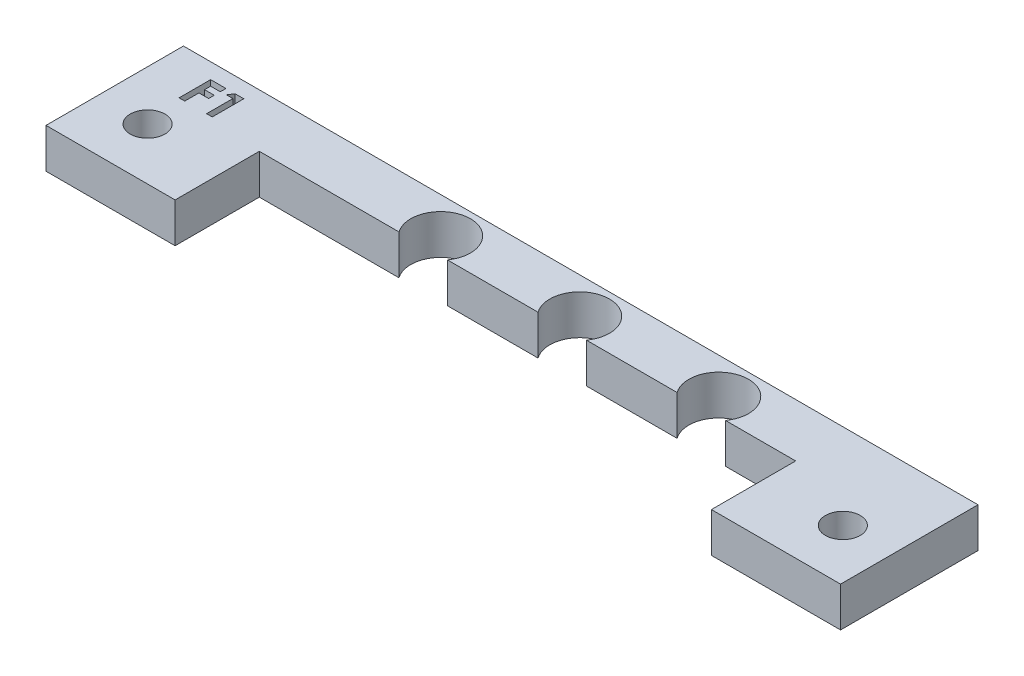
from build123d import *

# Parameters (mm, degrees)
SKETCH1_R           = 1.75
BOSS_EXTRUDE1_DEPTH = 4
CUT_EXTRUDE1_DEPTH  = 1


with BuildPart() as part:
    # Sketch1 → Boss-Extrude1 (new body)
    with BuildSketch(Plane(origin=(0, 0, 0), x_dir=(1, 0, 0), z_dir=(0, 1, 0))):
        with BuildLine():
            Line((-19.620223818, -18.81631662), (-6.620223818, -18.81631662))
            Line((-6.620223818, -18.81631662), (-6.620223818, -10.337442774))
            Line((-6.620223818, -10.337442774), (7.443077754, -10.337442546))
            ThreePointArc((7.443077754, -10.337442546), (9.879776182, -5.587442326), (12.31647461, -10.337442546))
            Line((12.31647461, -10.337442546), (21.443077647, -10.337442397))
            ThreePointArc((21.443077647, -10.337442397), (23.879776182, -5.587442326), (26.316474717, -10.337442397))
            Line((26.316474717, -10.337442397), (35.443077673, -10.337442433))
            ThreePointArc((35.443077673, -10.337442433), (37.879776182, -5.587442326), (40.316474692, -10.337442433))
            Line((40.316474692, -10.337442433), (47.379776182, -10.33744254))
            Line((47.379776182, -10.33744254), (47.379776182, -18.81631662))
            Line((47.379776182, -18.81631662), (60.379776182, -18.81631662))
            Line((60.379776182, -18.81631662), (60.379776182, -4.977921711))
            Line((60.379776182, -4.977921711), (-19.620223818, -4.977921711))
            Line((-19.620223818, -4.977921711), (-19.620223818, -18.81631662))
        make_face()
        with Locations((-14.620223818, -13.58744255)):
            Circle(SKETCH1_R, mode=Mode.SUBTRACT)
        with Locations((55.379776182, -13.58744255)):
            Circle(SKETCH1_R, mode=Mode.SUBTRACT)
    extrude(amount=BOSS_EXTRUDE1_DEPTH)

    # Sketch2 → Cut-Extrude1 (cut)
    with BuildSketch(Plane(origin=(0, 4, 0), x_dir=(1, 0, 0), z_dir=(0, 1, 0))):
        Polygon((-15.320752279, -6.539659084), (-13.773957408, -6.539659084), (-13.773957408, -7.109530878), (-14.750880484, -7.109530878), (-14.750880484, -7.720107802), (-13.773957408, -7.720107802), (-13.773957408, -8.289979596), (-14.750880484, -8.289979596), (-14.750880484, -9.714659084), (-15.320752279, -9.714659084), align=None)
        Polygon((-12.863816182, -6.539659084), (-11.982931767, -6.539659084), (-11.982931767, -9.714659084), (-12.552803561, -9.714659084), (-12.552803561, -7.06882575), (-13.204085613, -7.06882575), align=None)
    extrude(amount=-CUT_EXTRUDE1_DEPTH, mode=Mode.SUBTRACT)


solid = part.part
